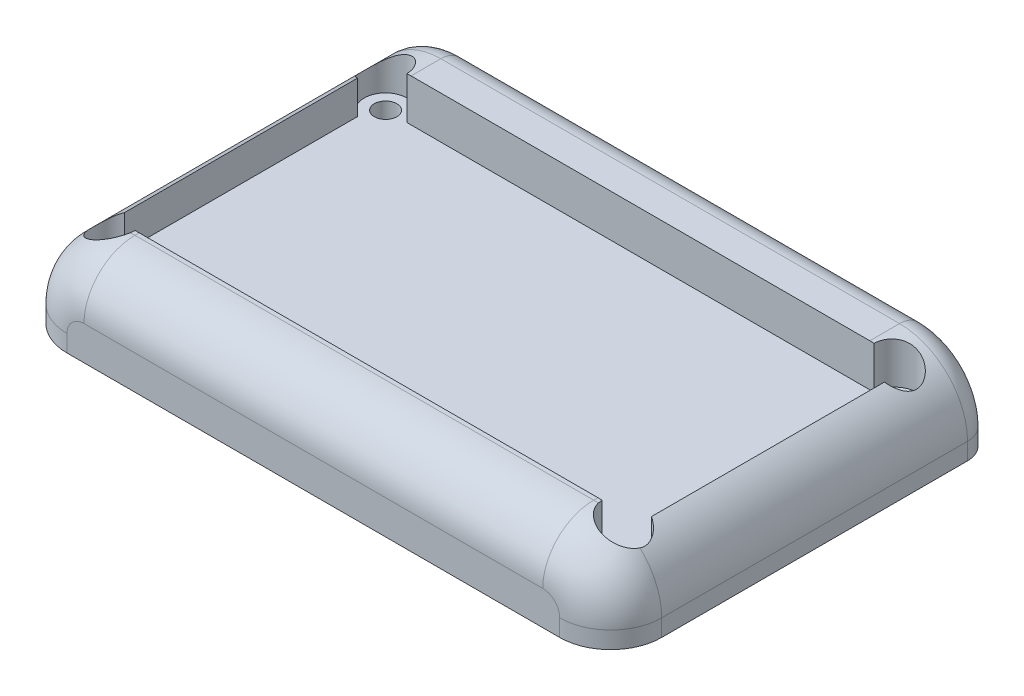
from build123d import *

# Parameters (mm, degrees)
SKETCH1_W           = 177.8
SKETCH1_H           = 114.3
BOSS_EXTRUDE1_DEPTH = 25.4
SKETCH3_R           = 3.3782
CUT_EXTRUDE2_DEPTH  = 109.694491581
SKETCH4_W           = 157.48
SKETCH4_H           = 81.28
CUT_EXTRUDE3_DEPTH  = 12.7
SKETCH3_3_R         = 6.35
SKETCH3_3_R_2       = 3.3782
CUT_EXTRUDE4_DEPTH  = 12.7
FILLET4_R           = 20.32
FILLET7_R           = 15.24
FILLET8_R           = 7.62


with BuildPart() as part:
    # Sketch1 → Boss-Extrude1 (new body)
    with BuildSketch(Plane(origin=(0, 0, 0), x_dir=(1, 0, 0), z_dir=(0, 1, 0))):
        Rectangle(SKETCH1_W, SKETCH1_H)
    extrude(amount=BOSS_EXTRUDE1_DEPTH)

    # Sketch3 → Cut-Extrude2 (cut, through all)
    with BuildSketch(Plane(origin=(0, 25.4, 0), x_dir=(1, 0, 0), z_dir=(0, 1, 0))):
        with Locations(Location((76.2, -40.64, 0), (0, 0, 270))):
            Circle(SKETCH3_R)
        with Locations(Location((76.2, 40.64, 0), (0, 0, 270))):
            Circle(SKETCH3_R)
        with Locations(Location((-76.2, -40.64, 0), (0, 0, 270))):
            Circle(SKETCH3_R)
        with Locations(Location((-76.2, 40.64, 0), (0, 0, 270))):
            Circle(SKETCH3_R)
    extrude(amount=-CUT_EXTRUDE2_DEPTH, mode=Mode.SUBTRACT)

    # Sketch4 → Cut-Extrude3 (cut)
    with BuildSketch(Plane(origin=(0, 25.4, 0), x_dir=(1, 0, 0), z_dir=(0, 1, 0))):
        Rectangle(SKETCH4_W, SKETCH4_H)
    extrude(amount=-CUT_EXTRUDE3_DEPTH, mode=Mode.SUBTRACT)

    # Sketch3<3> → Cut-Extrude4 (cut)
    # profile 1 of 4: a face of its own
    with BuildSketch(Plane(origin=(0, 25.4, 0), x_dir=(1, 0, 0), z_dir=(0, 1, 0))):
        with Locations((76.2, 40.64)):
            Circle(SKETCH3_3_R)
        with Locations(Location((76.2, 40.64, 0), (0, 0, 270))):
            Circle(SKETCH3_3_R_2, mode=Mode.SUBTRACT)
    # profile 2 of 4: a face of its own
    with BuildSketch(Plane(origin=(0, 25.4, 0), x_dir=(1, 0, 0), z_dir=(0, 1, 0))):
        with Locations((76.2, -40.64)):
            Circle(SKETCH3_3_R)
        with Locations(Location((76.2, -40.64, 0), (0, 0, 270))):
            Circle(SKETCH3_3_R_2, mode=Mode.SUBTRACT)
    # profile 3 of 4: a face of its own
    with BuildSketch(Plane(origin=(0, 25.4, 0), x_dir=(1, 0, 0), z_dir=(0, 1, 0))):
        with Locations((-76.2, -40.64)):
            Circle(SKETCH3_3_R)
        with Locations(Location((-76.2, -40.64, 0), (0, 0, 270))):
            Circle(SKETCH3_3_R_2, mode=Mode.SUBTRACT)
    # profile 4 of 4: a face of its own
    with BuildSketch(Plane(origin=(0, 25.4, 0), x_dir=(1, 0, 0), z_dir=(0, 1, 0))):
        with Locations((-76.2, 40.64)):
            Circle(SKETCH3_3_R)
        with Locations(Location((-76.2, 40.64, 0), (0, 0, 270))):
            Circle(SKETCH3_3_R_2, mode=Mode.SUBTRACT)
    extrude(amount=-CUT_EXTRUDE4_DEPTH, mode=Mode.SUBTRACT)

    # Fillet4
    # the kernel refuses this fillet: 20.32 mm, written as the material it takes off along each edge
    with BuildSketch(Plane(origin=(88.9, 25.4, 107.95), x_dir=(-1, 0, 0), z_dir=(0, 0, -1)), Plane(origin=(-88.9, 25.4, -107.95), x_dir=(1, 0, 0), z_dir=(0, 0, 1))) as fillet4_piece_1:
        with BuildLine():
            CenterArc((FILLET4_R, -FILLET4_R), FILLET4_R, 90, 90)
            Line((0, -FILLET4_R), (0, 0))
            Line((0, 0), (FILLET4_R, 0))
        make_face()
    extrude(amount=215.9, mode=Mode.SUBTRACT)

    # Fillet7
    # the kernel refuses this fillet: 15.24 mm, written as the material it takes off along each edge
    with BuildSketch(Plane(origin=(-68.58, 25.4, 57.15), x_dir=(0, -1, 0), z_dir=(1, 0, 0))) as fillet7_piece_1:
        with BuildLine():
            CenterArc((FILLET7_R, FILLET7_R), FILLET7_R, 180, 90)
            Line((0, FILLET7_R), (0, 0))
            Line((0, 0), (FILLET7_R, 0))
        make_face()
    extrude(amount=137.16, mode=Mode.SUBTRACT)
    with BuildSketch(Plane(origin=(88.9, -38.1, 57.15), x_dir=(-1, 0, 0), z_dir=(0, 1, 0))) as fillet7_piece_2:
        with BuildLine():
            CenterArc((FILLET7_R, -FILLET7_R), FILLET7_R, 90, 90)
            Line((0, -FILLET7_R), (0, 0))
            Line((0, 0), (FILLET7_R, 0))
        make_face()
    extrude(amount=43.18, mode=Mode.SUBTRACT)
    with BuildSketch(Plane(origin=(-88.9, -38.1, 57.15), x_dir=(1, 0, 0), z_dir=(0, 1, 0))) as fillet7_piece_3:
        with BuildLine():
            CenterArc((FILLET7_R, FILLET7_R), FILLET7_R, 180, 90)
            Line((0, FILLET7_R), (0, 0))
            Line((0, 0), (FILLET7_R, 0))
        make_face()
    extrude(amount=43.18, mode=Mode.SUBTRACT)
    with BuildSketch(Plane(origin=(-68.58, 5.08, 57.15), x_dir=(-1, 0, 0), z_dir=(0, -1, 0))) as fillet7_piece_4:
        with BuildLine():
            CenterArc((20.32 - FILLET7_R, FILLET7_R), FILLET7_R, 270, 90)
            Line((20.32, FILLET7_R), (20.32, 0))
            Line((20.32, 0), (20.32 - FILLET7_R, 0))
        make_face()
    revolve(axis=Axis((-68.58, 5.08, 57.15), (0, 0, -1)), revolution_arc=90, mode=Mode.SUBTRACT)
    with BuildSketch(Plane(origin=(68.58, 5.08, 57.15), x_dir=(1, 0, 0), z_dir=(0, -1, 0))) as fillet7_piece_5:
        with BuildLine():
            CenterArc((20.32 - FILLET7_R, -FILLET7_R), FILLET7_R, 0, 90)
            Line((20.32, -FILLET7_R), (20.32, 0))
            Line((20.32, 0), (20.32 - FILLET7_R, 0))
        make_face()
    revolve(axis=Axis((68.58, 5.08, 57.15), (0, 0, 1)), revolution_arc=90, mode=Mode.SUBTRACT)

    # Fillet8
    fillet8_edges = [part.edges().sort_by_distance(p)[0] for p in [
        (0, 25.4, -57.15),
        (-88.9, 2.54, -57.15),
        (88.9, 2.54, -57.15),
        (-82.948409794, 19.448409794, -57.15),
        (82.948409794, 19.448409794, -57.15),
    ]]
    fillet(fillet8_edges, radius=FILLET8_R)


solid = part.part
